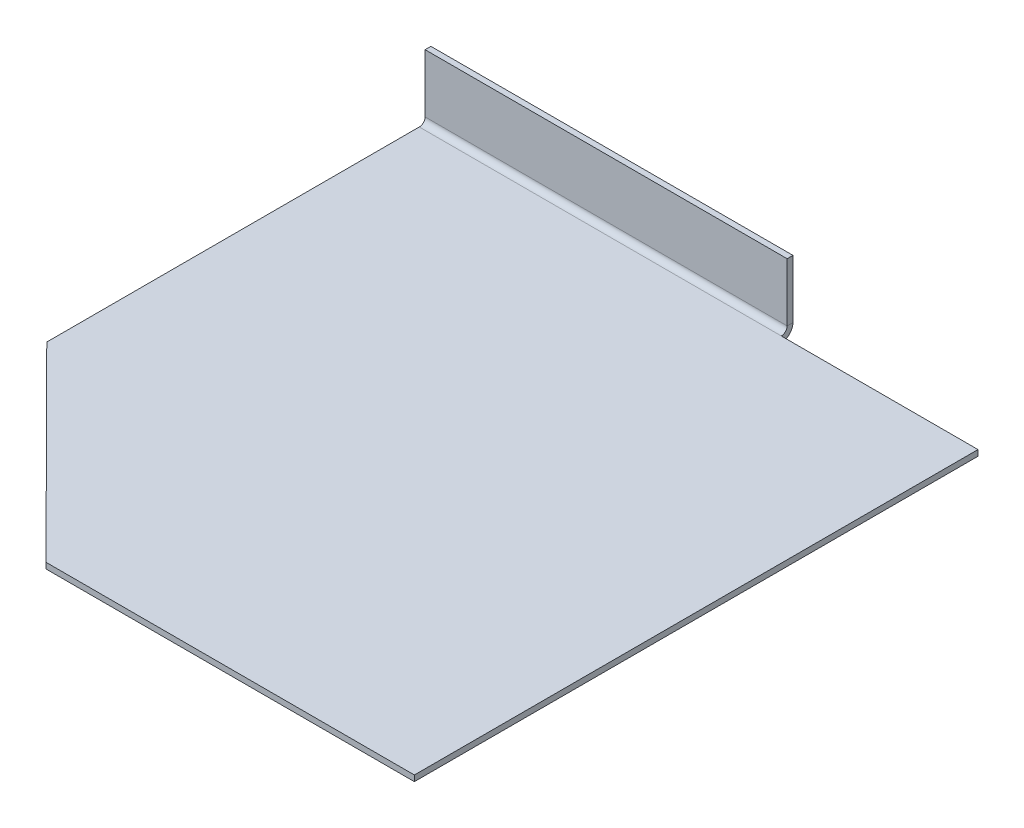
from build123d import *

# Parameters (mm, degrees)
BASE_FLANGE1_START = -3.175
BASE_FLANGE1_DEPTH = 3.175
EDGE_FLANGE1_DEPTH = 197.512880056


# Read off the part's stored shape, not the designer's step: Base-Flange1
# Sheet-metal steps are written as plain solids
with BuildPart() as part:
    # Base-Flange1 outline → Base-Flange1 (new body)
    with BuildSketch(Plane(origin=(0, 0, 0), x_dir=(1, 0, 0), z_dir=(0, 1, 0)).offset(BASE_FLANGE1_START)):
        Polygon((50.84064, 599.346330946), (50.84064, 396.146330946), (154.686, 291.879330946), (355.64064, 291.879330946), (355.64064, 599.346330946), align=None)
    extrude(amount=BASE_FLANGE1_DEPTH)

    # Edge-Flange1 section (across the edge) → Edge-Flange1 (add)
    with BuildSketch(Plane(origin=(248.353520056, 0, -602.521330946), x_dir=(0, 0, 1), z_dir=(-1, 0, 0))):
        with BuildLine():
            Line((-3.175, 3.175), (-3.175, 34.925))
            Line((-3.175, 34.925), (0, 34.925))
            Line((0, 34.925), (0, 3.175))
            ThreePointArc((0, 3.175), (0.92993597, 0.92993597), (3.175, 0))
            Line((3.175, 0), (3.175, -3.175))
            ThreePointArc((3.175, -3.175), (-1.315128061, -1.315128061), (-3.175, 3.175))
        make_face()
    extrude(amount=EDGE_FLANGE1_DEPTH)


solid = part.part
